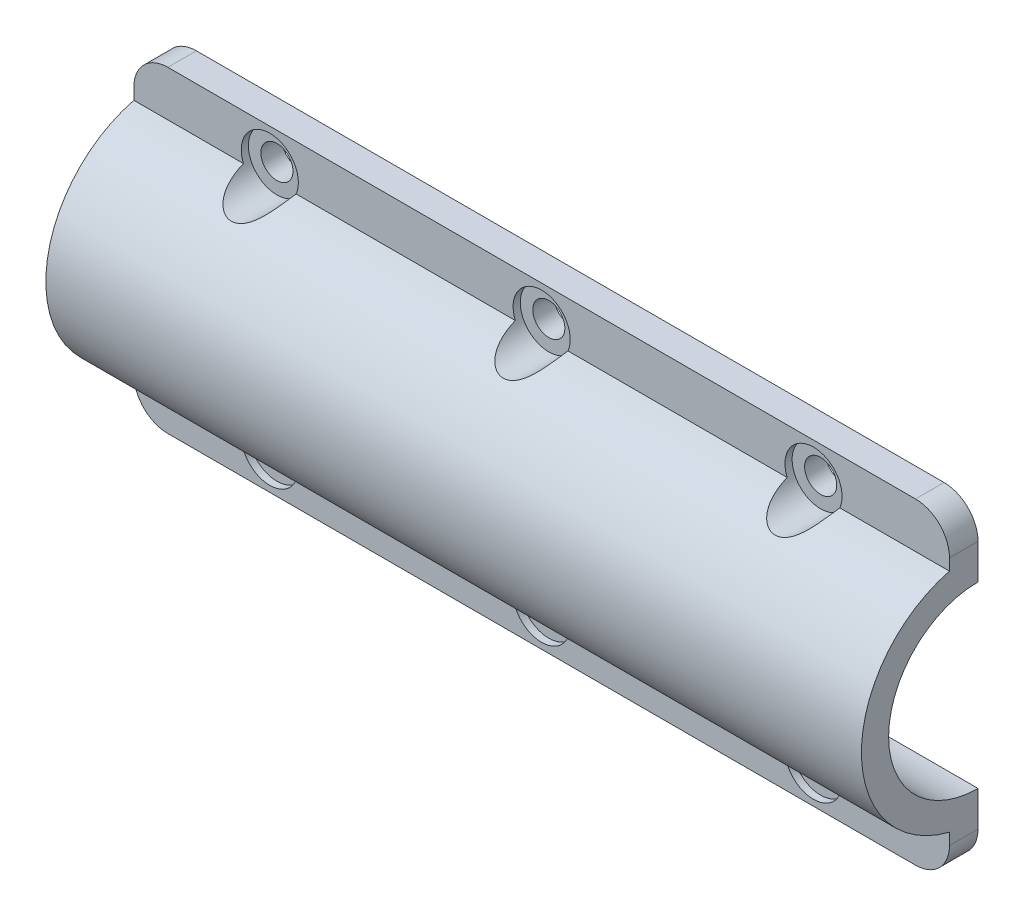
from build123d import *

# Parameters (mm, degrees)
BOSS_EXTRUDE1_DEPTH  = 114.3
CUT_EXTRUDE1_START   = -1
SKETCH2_R            = 4
CUT_EXTRUDE1_DEPTH   = 7.35
M4_CLEARANCE_HOLE1_D = 4.5
FILLET1_R            = 4.7625


with BuildPart() as part:
    # Sketch1 → Boss-Extrude1 (new body)
    with BuildSketch(Plane(origin=(0, 0, 0), x_dir=(0, 0, -1), z_dir=(1, 0, 0))):
        with BuildLine():
            Line((0, 22.225), (-4, 22.225))
            Line((-4, 22.225), (-4, 15.839643355))
            ThreePointArc((-4, 15.839643355), (-16.3369, 0), (-4, -15.839643355))
            Line((-4, -15.839643355), (-4, -22.225))
            Line((-4, -22.225), (0, -22.225))
            Line((0, -22.225), (0, -12.5269))
            ThreePointArc((0, -12.5269), (-12.5269, 0), (0, 12.5269))
            Line((0, 12.5269), (0, 22.225))
        make_face()
    extrude(amount=BOSS_EXTRUDE1_DEPTH)

    # Sketch2 → Cut-Extrude1 (cut)
    with BuildSketch(Plane.XY.offset(4).offset(CUT_EXTRUDE1_START)):
        with Locations((19.05, -17.37595)):
            Circle(SKETCH2_R)
        with Locations((57.15, -17.37595)):
            Circle(SKETCH2_R)
        with Locations((95.25, -17.37595)):
            Circle(SKETCH2_R)
    cut_extrude1 = extrude(amount=CUT_EXTRUDE1_DEPTH, mode=Mode.SUBTRACT)

    # M4 Clearance Hole1 (through all)
    with Locations(Plane.XY.offset(4)):
        with Locations((19.05, -17.37595), (57.15, -17.37595), (95.25, -17.37595)):
            m4_clearance_hole1 = Hole(M4_CLEARANCE_HOLE1_D / 2)

    # Mirror1: Cut-Extrude1, M4 Clearance Hole1 across plane
    add(cut_extrude1.mirror(Plane.ZX), mode=Mode.SUBTRACT)
    add(m4_clearance_hole1.mirror(Plane.ZX), mode=Mode.SUBTRACT)

    # Fillet1
    fillet1_edges = [part.edges().sort_by_distance(p)[0] for p in [
        (114.3, 22.225, 2),
        (114.3, -22.225, 2),
        (0, 22.225, 2),
        (0, -22.225, 2),
    ]]
    fillet(fillet1_edges, radius=FILLET1_R)


solid = part.part
